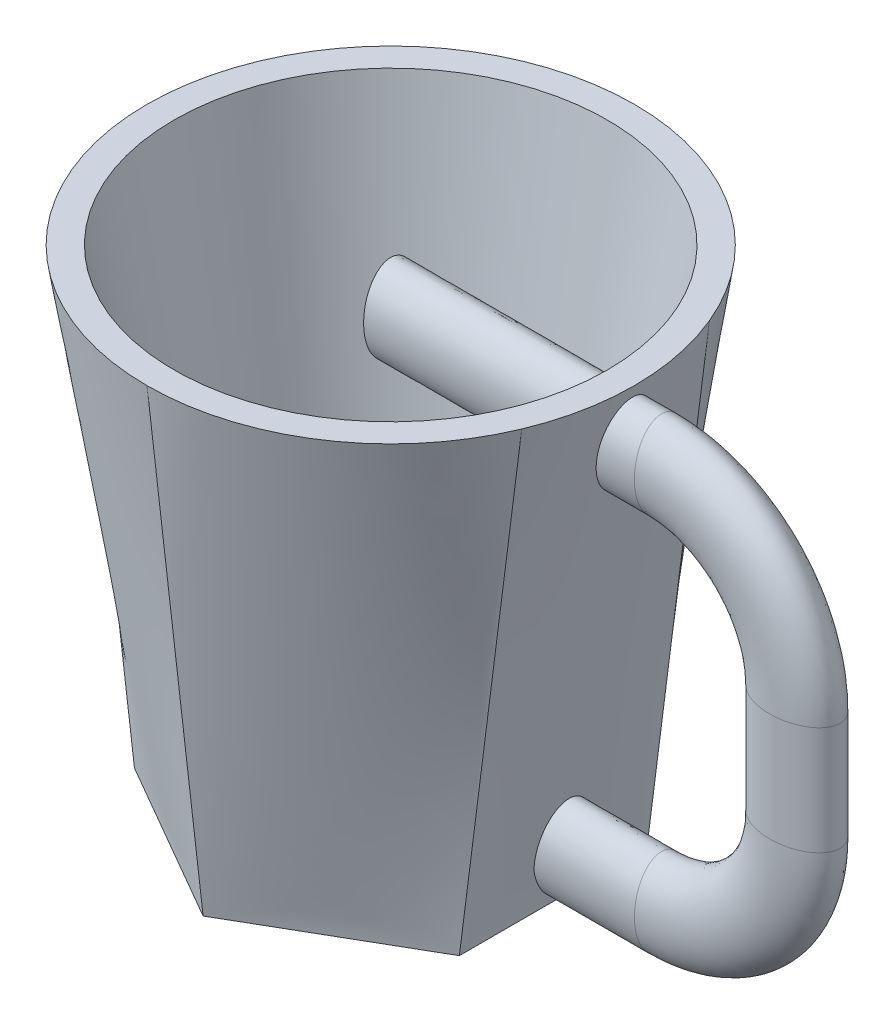
from build123d import *

# Parameters (mm, degrees)
SKETCH5_RX = 8
SKETCH5_RY = 5


with BuildPart() as part:
    # Loft4: read off the stored shape, not the designer's step
    # Loft4: loft between two sections, ruled curve by curve
    loft4_from = [
        Edge.make_bspline([(-30, 0, -17.320508076), (-30, 0, -14.43375673), (-30, 0, -11.547005384), (-30, 0, -5.773502692), (-30, 0, -2.886751346), (-30, 0, 2.886751346), (-30, 0, 5.773502692), (-30, 0, 11.547005384), (-30, 0, 14.43375673), (-30, 0, 17.320508076)], [0, 0, 0, 0, 0.25, 0.25, 0.5, 0.5, 0.75, 0.75, 1, 1, 1, 1], 3),
        Edge.make_bspline([(-30, 0, 17.320508076), (-28.75, 0, 18.042195912), (-27.5, 0, 18.763883749), (-25, 0, 20.207259422), (-23.75, 0, 20.928947258), (-21.25, 0, 22.372322931), (-20, 0, 23.094010768), (-17.5, 0, 24.537386441), (-16.25, 0, 25.259074277), (-13.75, 0, 26.70244995), (-12.5, 0, 27.424137787), (-10, 0, 28.867513459), (-8.75, 0, 29.589201296), (-6.25, 0, 31.032576969), (-5, 0, 31.754264805), (-2.5, 0, 33.197640478), (-1.25, 0, 33.919328315), (0, 0, 34.641016151)], [0, 0, 0, 0, 0.125, 0.125, 0.25, 0.25, 0.375, 0.375, 0.5, 0.5, 0.625, 0.625, 0.75, 0.75, 0.875, 0.875, 1, 1, 1, 1], 3),
        Edge.make_bspline([(0, 0, -34.641016151), (-1.25, 0, -33.919328315), (-2.5, 0, -33.197640478), (-5, 0, -31.754264805), (-6.25, 0, -31.032576969), (-8.75, 0, -29.589201296), (-10, 0, -28.867513459), (-12.5, 0, -27.424137787), (-13.75, 0, -26.70244995), (-16.25, 0, -25.259074277), (-17.5, 0, -24.537386441), (-20, 0, -23.094010768), (-21.25, 0, -22.372322931), (-23.75, 0, -20.928947258), (-25, 0, -20.207259422), (-27.5, 0, -18.763883749), (-28.75, 0, -18.042195912), (-30, 0, -17.320508076)], [0, 0, 0, 0, 0.125, 0.125, 0.25, 0.25, 0.375, 0.375, 0.5, 0.5, 0.625, 0.625, 0.75, 0.75, 0.875, 0.875, 1, 1, 1, 1], 3),
        Edge.make_bspline([(0, 0, 34.641016151), (1.25, 0, 33.919328315), (2.5, 0, 33.197640478), (5, 0, 31.754264805), (6.25, 0, 31.032576969), (8.75, 0, 29.589201296), (10, 0, 28.867513459), (12.5, 0, 27.424137787), (13.75, 0, 26.70244995), (16.25, 0, 25.259074277), (17.5, 0, 24.537386441), (20, 0, 23.094010768), (21.25, 0, 22.372322931), (23.75, 0, 20.928947258), (25, 0, 20.207259422), (27.5, 0, 18.763883749), (28.75, 0, 18.042195912), (30, 0, 17.320508076)], [0, 0, 0, 0, 0.125, 0.125, 0.25, 0.25, 0.375, 0.375, 0.5, 0.5, 0.625, 0.625, 0.75, 0.75, 0.875, 0.875, 1, 1, 1, 1], 3),
        Edge.make_bspline([(30, 0, 17.320508076), (30, 0, 14.43375673), (30, 0, 11.547005384), (30, 0, 5.773502692), (30, 0, 2.886751346), (30, 0, -2.886751346), (30, 0, -5.773502692), (30, 0, -11.547005384), (30, 0, -14.43375673), (30, 0, -17.320508076)], [0, 0, 0, 0, 0.25, 0.25, 0.5, 0.5, 0.75, 0.75, 1, 1, 1, 1], 3),
        Edge.make_bspline([(30, 0, -17.320508076), (28.75, 0, -18.042195912), (27.5, 0, -18.763883749), (25, 0, -20.207259422), (23.75, 0, -20.928947258), (21.25, 0, -22.372322931), (20, 0, -23.094010768), (17.5, 0, -24.537386441), (16.25, 0, -25.259074277), (13.75, 0, -26.70244995), (12.5, 0, -27.424137787), (10, 0, -28.867513459), (8.75, 0, -29.589201296), (6.25, 0, -31.032576969), (5, 0, -31.754264805), (2.5, 0, -33.197640478), (1.25, 0, -33.919328315), (0, 0, -34.641016151)], [0, 0, 0, 0, 0.125, 0.125, 0.25, 0.25, 0.375, 0.375, 0.5, 0.5, 0.625, 0.625, 0.75, 0.75, 0.875, 0.875, 1, 1, 1, 1], 3),
    ]
    loft4_to = [
        Edge.make_bspline([(-41.529784127, 90, -17.328503408), (-42.641921277, 90, -14.66313672), (-43.516929817, 90, -11.837315184), (-44.696291344, 90, -6.007224944), (-45, 90, -3.003908466), (-45, 90, 3.003908466), (-44.696291344, 90, 6.007224944), (-43.516929817, 90, 11.837315184), (-42.641921277, 90, 14.66313672), (-41.529784127, 90, 17.328503408)], [0, 0, 0, 0, 0.25, 0.25, 0.5, 0.5, 0.75, 0.75, 1, 1, 1, 1], 3),
        Edge.make_bspline([(-41.529784127, 90, 17.328503408), (-40.729074815, 90, 19.247496878), (-39.777789859, 90, 21.151522698), (-37.570599339, 90, 24.861808941), (-36.314606538, 90, 26.667831461), (-33.514793134, 90, 30.111169424), (-31.97099595, 90, 31.748210838), (-28.634038008, 90, 34.787718246), (-26.841023862, 90, 36.189934961), (-23.063231401, 90, 38.7070964), (-21.078697862, 90, 39.82187803), (-16.988596227, 90, 41.73105644), (-14.883314643, 90, 42.525413908), (-10.627366679, 90, 43.783363968), (-8.476962214, 90, 44.247040467), (-4.202857877, 90, 44.855272423), (-2.079343969, 90, 45), (0, 90, 45)], [0, 0, 0, 0, 0.125, 0.125, 0.25, 0.25, 0.375, 0.375, 0.5, 0.5, 0.625, 0.625, 0.75, 0.75, 0.875, 0.875, 1, 1, 1, 1], 3),
        Edge.make_bspline([(0, 90, -45), (-2.079343969, 90, -45), (-4.202857877, 90, -44.855272423), (-8.476962214, 90, -44.247040467), (-10.627366679, 90, -43.783363968), (-14.883314643, 90, -42.525413908), (-16.988596227, 90, -41.73105644), (-21.078697862, 90, -39.82187803), (-23.063231401, 90, -38.7070964), (-26.841023862, 90, -36.189934961), (-28.634038008, 90, -34.787718246), (-31.97099595, 90, -31.748210838), (-33.514793134, 90, -30.111169424), (-36.314606538, 90, -26.667831461), (-37.570599339, 90, -24.861808941), (-39.777789859, 90, -21.151522698), (-40.729074815, 90, -19.247496878), (-41.529784127, 90, -17.328503408)], [0, 0, 0, 0, 0.125, 0.125, 0.25, 0.25, 0.375, 0.375, 0.5, 0.5, 0.625, 0.625, 0.75, 0.75, 0.875, 0.875, 1, 1, 1, 1], 3),
        Edge.make_bspline([(0, 90, 45), (2.079343969, 90, 45), (4.202857877, 90, 44.855272423), (8.476962214, 90, 44.247040467), (10.627366679, 90, 43.783363968), (14.883314643, 90, 42.525413908), (16.988596227, 90, 41.73105644), (21.078697862, 90, 39.82187803), (23.063231401, 90, 38.7070964), (26.841023862, 90, 36.189934961), (28.634038008, 90, 34.787718246), (31.97099595, 90, 31.748210838), (33.514793134, 90, 30.111169424), (36.314606538, 90, 26.667831461), (37.570599339, 90, 24.861808941), (39.777789859, 90, 21.151522698), (40.729074815, 90, 19.247496878), (41.529784127, 90, 17.328503408)], [0, 0, 0, 0, 0.125, 0.125, 0.25, 0.25, 0.375, 0.375, 0.5, 0.5, 0.625, 0.625, 0.75, 0.75, 0.875, 0.875, 1, 1, 1, 1], 3),
        Edge.make_bspline([(41.529784127, 90, 17.328503408), (42.641921277, 90, 14.66313672), (43.516929817, 90, 11.837315184), (44.696291344, 90, 6.007224944), (45, 90, 3.003908466), (45, 90, -3.003908466), (44.696291344, 90, -6.007224944), (43.516929817, 90, -11.837315184), (42.641921277, 90, -14.66313672), (41.529784127, 90, -17.328503408)], [0, 0, 0, 0, 0.25, 0.25, 0.5, 0.5, 0.75, 0.75, 1, 1, 1, 1], 3),
        Edge.make_bspline([(41.529784127, 90, -17.328503408), (40.729074815, 90, -19.247496878), (39.777789859, 90, -21.151522698), (37.570599339, 90, -24.861808941), (36.314606538, 90, -26.667831461), (33.514793134, 90, -30.111169424), (31.97099595, 90, -31.748210838), (28.634038008, 90, -34.787718246), (26.841023862, 90, -36.189934961), (23.063231401, 90, -38.7070964), (21.078697862, 90, -39.82187803), (16.988596227, 90, -41.73105644), (14.883314643, 90, -42.525413908), (10.627366679, 90, -43.783363968), (8.476962214, 90, -44.247040467), (4.202857877, 90, -44.855272423), (2.079343969, 90, -45), (0, 90, -45)], [0, 0, 0, 0, 0.125, 0.125, 0.25, 0.25, 0.375, 0.375, 0.5, 0.5, 0.625, 0.625, 0.75, 0.75, 0.875, 0.875, 1, 1, 1, 1], 3),
    ]
    loft4 = Solid(Shell([*[Face.make_surface_from_curves(loft4_from[k], loft4_to[k]) for k in range(6)], Face(Wire(loft4_from)), Face(Wire(loft4_to))]))
    add(loft4)

    # Sketch3 → Cut-Revolve1 (revolve, cut)
    with BuildSketch(Plane.XY, mode=Mode.PRIVATE) as cut_revolve1_sk:
        with BuildLine():
            Line((-40, 90), (-29.797917866, 32.141117071))
            ThreePointArc((-29.797917866, 32.141117071), (-19.528205808, 13.488162044), (0, 5))
            Line((0, 5), (0, 90))
            Line((0, 90), (-40, 90))
        make_face()
    revolve(cut_revolve1_sk.sketch.rotate(Axis((0, 5, 0), (0, 1, 0)), 180), axis=Axis((0, 5, 0), (0, 1, 0)), mode=Mode.SUBTRACT)

    # Sweep6: sweep along a path in Sketch4
    with BuildLine(Plane.XY) as sweep6_path:
        Line((0, 80), (50, 80))
        ThreePointArc((50, 80), (67.67766953, 72.67766953), (75, 55))
        Line((75, 55), (75, 35))
        ThreePointArc((75, 35), (67.67766953, 17.32233047), (50, 10))
        Line((50, 10), (31.281087125, 10))
    # Sketch5 → Sweep6 (sweep)
    with BuildSketch(Plane(origin=(0, 0, 0), x_dir=(0, 0, -1), z_dir=(1, 0, 0))):
        with Locations(Location((0, 80), (0, 0, 90))):
            Ellipse(SKETCH5_RX, SKETCH5_RY)
    sweep(path=sweep6_path.line)


solid = part.part
